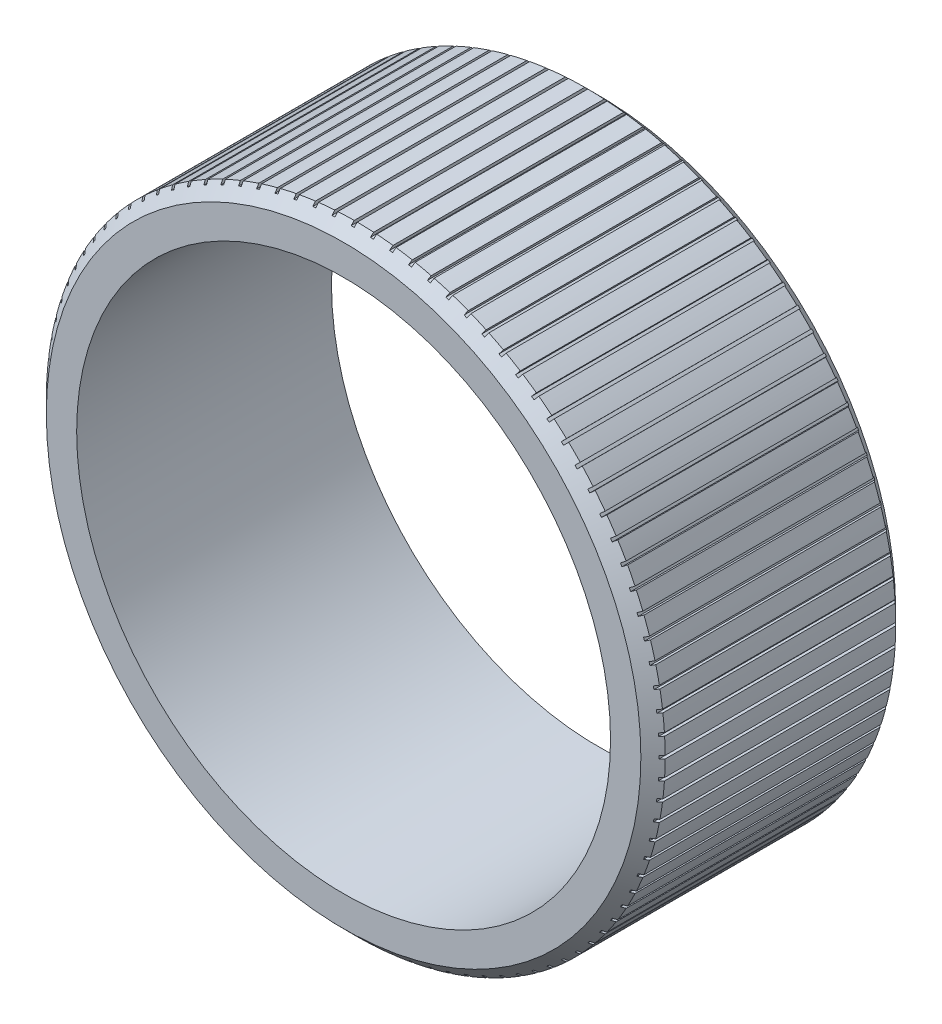
from build123d import *

# Parameters (mm, degrees)
SKETCH_1_R          = 51
SKETCH_1_R_2        = 44
EXTRUDE_1_DEPTH     = 42
CHAMFER_1_SIZE      = 2
CUT_EXTRUDE_START   = -40.5
CUT_EXTRUDE_1_DEPTH = 39


with BuildPart() as part:
    # 草图1 → 凸台-拉伸1 (new body)
    with BuildSketch(Plane.XY):
        with Locations(Location((0, 0, 0), (0, 0, 180))):
            Circle(SKETCH_1_R)
        with Locations(Location((0, 0, 0), (0, 0, 180))):
            Circle(SKETCH_1_R_2, mode=Mode.SUBTRACT)
    extrude(amount=EXTRUDE_1_DEPTH)

    # 倒角1
    chamfer_1_edges = [part.edges().sort_by_distance(p)[0] for p in [
        (51, 0, 0),
        (51, 0, 42),
    ]]
    chamfer(chamfer_1_edges, length=CHAMFER_1_SIZE)

    # 草图4 → 切除-拉伸1 (cut)
    with BuildSketch(Plane(origin=(0, 0, 0), x_dir=(-1, 0, 0), z_dir=(0, 0, -1)).offset(CUT_EXTRUDE_START)):
        with BuildLine():
            Line((-0.25, 50.999387251), (-0.25, 50.499381184))
            ThreePointArc((-0.25, 50.499381184), (0, 50.5), (0.25, 50.499381184))
            Line((0.25, 50.499381184), (0.25, 50.999387251))
            ThreePointArc((0.25, 50.999387251), (0, 51), (-0.25, 50.999387251))
        make_face()
        with BuildLine():
            Line((3.451784703, 50.88305398), (3.420389063, 50.384034561))
            ThreePointArc((3.420389063, 50.384034561), (3.170921236, 50.400349786), (2.921375698, 50.415429821))
            Line((2.921375698, 50.415429821), (2.952771339, 50.91444924))
            ThreePointArc((2.952771339, 50.91444924), (3.202316496, 50.89936315), (3.451784703, 50.88305398))
        make_face()
        with BuildLine():
            Line((6.639946789, 50.565908542), (6.577279412, 50.069845172))
            ThreePointArc((6.577279412, 50.069845172), (6.329328295, 50.101792416), (6.081222061, 50.132511789))
            Line((6.081222061, 50.132511789), (6.143889439, 50.628575158))
            ThreePointArc((6.143889439, 50.628575158), (6.391994912, 50.597849767), (6.639946789, 50.565908542))
        make_face()
        with BuildLine():
            Line((9.801904039, 50.049202563), (9.708212245, 49.558052978))
            ThreePointArc((9.708212245, 49.558052978), (9.462756387, 49.605506162), (9.217068619, 49.651743636))
            Line((9.217068619, 49.651743636), (9.310760414, 50.14289322))
            ThreePointArc((9.310760414, 50.14289322), (9.556447044, 50.096649787), (9.801904039, 50.049202563))
        make_face()
        with BuildLine():
            Line((12.925177651, 49.334975248), (12.800831199, 48.850677791))
            ThreePointArc((12.800831199, 48.850677791), (12.558839302, 48.913449637), (12.316539618, 48.975022734))
            Line((12.316539618, 48.975022734), (12.440886071, 49.459320191))
            ThreePointArc((12.440886071, 49.459320191), (12.683184245, 49.397741218), (12.925177651, 49.334975248))
        make_face()
        with BuildLine():
            Line((15.997441492, 48.426045324), (15.84293112, 47.950511296))
            ThreePointArc((15.84293112, 47.950511296), (15.605358216, 48.028354073), (15.367402862, 48.105019793))
            Line((15.367402862, 48.105019793), (15.521913234, 48.580553821))
            ThreePointArc((15.521913234, 48.580553821), (15.759866713, 48.503882331), (15.997441492, 48.426045324))
        make_face()
        with BuildLine():
            Line((19.006570741, 47.325999923), (18.822506231, 46.861106039))
            ThreePointArc((18.822506231, 46.861106039), (18.590289911, 46.953712537), (18.357617988, 47.045168315))
            Line((18.357617988, 47.045168315), (18.541682498, 47.510062199))
            ThreePointArc((18.541682498, 47.510062199), (18.774352187, 47.41860078), (19.006570741, 47.325999923))
        make_face()
        with BuildLine():
            Line((21.940689737, 46.039180421), (21.727797508, 45.586761405))
            ThreePointArc((21.727797508, 45.586761405), (21.501854224, 45.69376615), (21.275383982, 45.799651051))
            Line((21.275383982, 45.799651051), (21.488276211, 46.252070067))
            ThreePointArc((21.488276211, 46.252070067), (21.71474387, 46.146179676), (21.940689737, 46.039180421))
        make_face()
        with BuildLine():
            Line((24.788218855, 44.570665308), (24.547339095, 44.132506651))
            ThreePointArc((24.547339095, 44.132506651), (24.328560542, 44.253487342), (24.109185755, 44.373383488))
            Line((24.109185755, 44.373383488), (24.350065515, 44.811542145))
            ThreePointArc((24.350065515, 44.811542145), (24.569437379, 44.691640682), (24.788218855, 44.570665308))
        make_face()
        with BuildLine():
            Line((27.537920198, 42.926250141), (27.27000355, 42.504081056))
            ThreePointArc((27.27000355, 42.504081056), (27.059253146, 42.638560238), (26.847839587, 42.771994453))
            Line((26.847839587, 42.771994453), (27.115756235, 43.194163538))
            ThreePointArc((27.115756235, 43.194163538), (27.327166544, 43.060724201), (27.537920198, 42.926250141))
        make_face()
        with BuildLine():
            Line((30.178941951, 41.112424676), (29.885045759, 40.70791127))
            ThreePointArc((29.885045759, 40.70791127), (29.683155241, 40.855358216), (29.480537261, 41.001803897))
            Line((29.480537261, 41.001803897), (29.774433454, 41.406317302))
            ThreePointArc((29.774433454, 41.406317302), (29.977047867, 41.259866713), (30.178941951, 41.112424676))
        make_face()
        with BuildLine():
            Line((32.700861207, 39.136347253), (32.382145345, 38.751085957))
            ThreePointArc((32.382145345, 38.751085957), (32.189911482, 38.91091876), (31.996888724, 39.069797952))
            Line((31.996888724, 39.069797952), (32.315604586, 39.455059248))
            ThreePointArc((32.315604586, 39.455059248), (32.508623477, 39.296175382), (32.700861207, 39.136347253))
        make_face()
        with BuildLine():
            Line((35.093725104, 37.005816547), (34.751447398, 36.641327811))
            ThreePointArc((34.751447398, 36.641327811), (34.569628849, 36.812915685), (34.386963084, 36.983601364))
            Line((34.386963084, 36.983601364), (34.72924079, 37.3480901))
            ThreePointArc((34.72924079, 37.3480901), (34.911902402, 37.177399998), (35.093725104, 37.005816547))
        make_face()
        with BuildLine():
            Line((37.3480901, 34.72924079), (36.983601364, 34.386963084))
            ThreePointArc((36.983601364, 34.386963084), (36.812915685, 34.569628849), (36.641327811, 34.751447398))
            Line((36.641327811, 34.751447398), (37.005816547, 35.093725104))
            ThreePointArc((37.005816547, 35.093725104), (37.177399998, 34.911902402), (37.3480901, 34.72924079))
        make_face()
        with BuildLine():
            Line((39.455059248, 32.315604586), (39.069797952, 31.996888724))
            ThreePointArc((39.069797952, 31.996888724), (38.91091876, 32.189911482), (38.751085957, 32.382145345))
            Line((38.751085957, 32.382145345), (39.136347253, 32.700861207))
            ThreePointArc((39.136347253, 32.700861207), (39.296175382, 32.508623477), (39.455059248, 32.315604586))
        make_face()
        with BuildLine():
            Line((41.406317302, 29.774433454), (41.001803897, 29.480537261))
            ThreePointArc((41.001803897, 29.480537261), (40.855358216, 29.683155241), (40.70791127, 29.885045759))
            Line((40.70791127, 29.885045759), (41.112424676, 30.178941951))
            ThreePointArc((41.112424676, 30.178941951), (41.259866713, 29.977047867), (41.406317302, 29.774433454))
        make_face()
        with BuildLine():
            Line((43.194163538, 27.115756235), (42.771994453, 26.847839587))
            ThreePointArc((42.771994453, 26.847839587), (42.638560238, 27.059253146), (42.504081056, 27.27000355))
            Line((42.504081056, 27.27000355), (42.926250141, 27.537920198))
            ThreePointArc((42.926250141, 27.537920198), (43.060724201, 27.327166544), (43.194163538, 27.115756235))
        make_face()
        with BuildLine():
            Line((44.811542145, 24.350065515), (44.373383488, 24.109185755))
            ThreePointArc((44.373383488, 24.109185755), (44.253487342, 24.328560542), (44.132506651, 24.547339095))
            Line((44.132506651, 24.547339095), (44.570665308, 24.788218855))
            ThreePointArc((44.570665308, 24.788218855), (44.691640682, 24.569437379), (44.811542145, 24.350065515))
        make_face()
        with BuildLine():
            Line((46.252070067, 21.488276211), (45.799651051, 21.275383982))
            ThreePointArc((45.799651051, 21.275383982), (45.69376615, 21.501854224), (45.586761405, 21.727797508))
            Line((45.586761405, 21.727797508), (46.039180421, 21.940689737))
            ThreePointArc((46.039180421, 21.940689737), (46.146179676, 21.71474387), (46.252070067, 21.488276211))
        make_face()
        with BuildLine():
            Line((47.510062199, 18.541682498), (47.045168315, 18.357617988))
            ThreePointArc((47.045168315, 18.357617988), (46.953712537, 18.590289911), (46.861106039, 18.822506231))
            Line((46.861106039, 18.822506231), (47.325999923, 19.006570741))
            ThreePointArc((47.325999923, 19.006570741), (47.41860078, 18.774352187), (47.510062199, 18.541682498))
        make_face()
        with BuildLine():
            Line((48.580553821, 15.521913234), (48.105019793, 15.367402862))
            ThreePointArc((48.105019793, 15.367402862), (48.028354073, 15.605358216), (47.950511296, 15.84293112))
            Line((47.950511296, 15.84293112), (48.426045324, 15.997441492))
            ThreePointArc((48.426045324, 15.997441492), (48.503882331, 15.759866713), (48.580553821, 15.521913234))
        make_face()
        with BuildLine():
            Line((49.459320191, 12.440886071), (48.975022734, 12.316539618))
            ThreePointArc((48.975022734, 12.316539618), (48.913449637, 12.558839302), (48.850677791, 12.800831199))
            Line((48.850677791, 12.800831199), (49.334975248, 12.925177651))
            ThreePointArc((49.334975248, 12.925177651), (49.397741218, 12.683184245), (49.459320191, 12.440886071))
        make_face()
        with BuildLine():
            Line((50.14289322, 9.310760414), (49.651743636, 9.217068619))
            ThreePointArc((49.651743636, 9.217068619), (49.605506162, 9.462756387), (49.558052978, 9.708212245))
            Line((49.558052978, 9.708212245), (50.049202563, 9.801904039))
            ThreePointArc((50.049202563, 9.801904039), (50.096649787, 9.556447044), (50.14289322, 9.310760414))
        make_face()
        with BuildLine():
            Line((50.628575158, 6.143889439), (50.132511789, 6.081222061))
            ThreePointArc((50.132511789, 6.081222061), (50.101792416, 6.329328295), (50.069845172, 6.577279412))
            Line((50.069845172, 6.577279412), (50.565908542, 6.639946789))
            ThreePointArc((50.565908542, 6.639946789), (50.597849767, 6.391994912), (50.628575158, 6.143889439))
        make_face()
        with BuildLine():
            Line((50.91444924, 2.952771339), (50.415429821, 2.921375698))
            ThreePointArc((50.415429821, 2.921375698), (50.400349786, 3.170921236), (50.384034561, 3.420389063))
            Line((50.384034561, 3.420389063), (50.88305398, 3.451784703))
            ThreePointArc((50.88305398, 3.451784703), (50.89936315, 3.202316496), (50.91444924, 2.952771339))
        make_face()
        with BuildLine():
            Line((50.999387251, -0.25), (50.499381184, -0.25))
            ThreePointArc((50.499381184, -0.25), (50.5, 0), (50.499381184, 0.25))
            Line((50.499381184, 0.25), (50.999387251, 0.25))
            ThreePointArc((50.999387251, 0.25), (51, 0), (50.999387251, -0.25))
        make_face()
        with BuildLine():
            Line((50.88305398, -3.451784703), (50.384034561, -3.420389063))
            ThreePointArc((50.384034561, -3.420389063), (50.400349786, -3.170921236), (50.415429821, -2.921375698))
            Line((50.415429821, -2.921375698), (50.91444924, -2.952771339))
            ThreePointArc((50.91444924, -2.952771339), (50.89936315, -3.202316496), (50.88305398, -3.451784703))
        make_face()
        with BuildLine():
            Line((50.565908542, -6.639946789), (50.069845172, -6.577279412))
            ThreePointArc((50.069845172, -6.577279412), (50.101792416, -6.329328295), (50.132511789, -6.081222061))
            Line((50.132511789, -6.081222061), (50.628575158, -6.143889439))
            ThreePointArc((50.628575158, -6.143889439), (50.597849767, -6.391994912), (50.565908542, -6.639946789))
        make_face()
        with BuildLine():
            Line((50.049202563, -9.801904039), (49.558052978, -9.708212245))
            ThreePointArc((49.558052978, -9.708212245), (49.605506162, -9.462756387), (49.651743636, -9.217068619))
            Line((49.651743636, -9.217068619), (50.14289322, -9.310760414))
            ThreePointArc((50.14289322, -9.310760414), (50.096649787, -9.556447044), (50.049202563, -9.801904039))
        make_face()
        with BuildLine():
            Line((49.334975248, -12.925177651), (48.850677791, -12.800831199))
            ThreePointArc((48.850677791, -12.800831199), (48.913449637, -12.558839302), (48.975022734, -12.316539618))
            Line((48.975022734, -12.316539618), (49.459320191, -12.440886071))
            ThreePointArc((49.459320191, -12.440886071), (49.397741218, -12.683184245), (49.334975248, -12.925177651))
        make_face()
        with BuildLine():
            Line((48.426045324, -15.997441492), (47.950511296, -15.84293112))
            ThreePointArc((47.950511296, -15.84293112), (48.028354073, -15.605358216), (48.105019793, -15.367402862))
            Line((48.105019793, -15.367402862), (48.580553821, -15.521913234))
            ThreePointArc((48.580553821, -15.521913234), (48.503882331, -15.759866713), (48.426045324, -15.997441492))
        make_face()
        with BuildLine():
            Line((47.325999923, -19.006570741), (46.861106039, -18.822506231))
            ThreePointArc((46.861106039, -18.822506231), (46.953712537, -18.590289911), (47.045168315, -18.357617988))
            Line((47.045168315, -18.357617988), (47.510062199, -18.541682498))
            ThreePointArc((47.510062199, -18.541682498), (47.41860078, -18.774352187), (47.325999923, -19.006570741))
        make_face()
        with BuildLine():
            Line((46.039180421, -21.940689737), (45.586761405, -21.727797508))
            ThreePointArc((45.586761405, -21.727797508), (45.69376615, -21.501854224), (45.799651051, -21.275383982))
            Line((45.799651051, -21.275383982), (46.252070067, -21.488276211))
            ThreePointArc((46.252070067, -21.488276211), (46.146179676, -21.71474387), (46.039180421, -21.940689737))
        make_face()
        with BuildLine():
            Line((44.570665308, -24.788218855), (44.132506651, -24.547339095))
            ThreePointArc((44.132506651, -24.547339095), (44.253487342, -24.328560542), (44.373383488, -24.109185755))
            Line((44.373383488, -24.109185755), (44.811542145, -24.350065515))
            ThreePointArc((44.811542145, -24.350065515), (44.691640682, -24.569437379), (44.570665308, -24.788218855))
        make_face()
        with BuildLine():
            Line((42.926250141, -27.537920198), (42.504081056, -27.27000355))
            ThreePointArc((42.504081056, -27.27000355), (42.638560238, -27.059253146), (42.771994453, -26.847839587))
            Line((42.771994453, -26.847839587), (43.194163538, -27.115756235))
            ThreePointArc((43.194163538, -27.115756235), (43.060724201, -27.327166544), (42.926250141, -27.537920198))
        make_face()
        with BuildLine():
            Line((41.112424676, -30.178941951), (40.70791127, -29.885045759))
            ThreePointArc((40.70791127, -29.885045759), (40.855358216, -29.683155241), (41.001803897, -29.480537261))
            Line((41.001803897, -29.480537261), (41.406317302, -29.774433454))
            ThreePointArc((41.406317302, -29.774433454), (41.259866713, -29.977047867), (41.112424676, -30.178941951))
        make_face()
        with BuildLine():
            Line((39.136347253, -32.700861207), (38.751085957, -32.382145345))
            ThreePointArc((38.751085957, -32.382145345), (38.91091876, -32.189911482), (39.069797952, -31.996888724))
            Line((39.069797952, -31.996888724), (39.455059248, -32.315604586))
            ThreePointArc((39.455059248, -32.315604586), (39.296175382, -32.508623477), (39.136347253, -32.700861207))
        make_face()
        with BuildLine():
            Line((37.005816547, -35.093725104), (36.641327811, -34.751447398))
            ThreePointArc((36.641327811, -34.751447398), (36.812915685, -34.569628849), (36.983601364, -34.386963084))
            Line((36.983601364, -34.386963084), (37.3480901, -34.72924079))
            ThreePointArc((37.3480901, -34.72924079), (37.177399998, -34.911902402), (37.005816547, -35.093725104))
        make_face()
        with BuildLine():
            Line((34.72924079, -37.3480901), (34.386963084, -36.983601364))
            ThreePointArc((34.386963084, -36.983601364), (34.569628849, -36.812915685), (34.751447398, -36.641327811))
            Line((34.751447398, -36.641327811), (35.093725104, -37.005816547))
            ThreePointArc((35.093725104, -37.005816547), (34.911902402, -37.177399998), (34.72924079, -37.3480901))
        make_face()
        with BuildLine():
            Line((32.315604586, -39.455059248), (31.996888724, -39.069797952))
            ThreePointArc((31.996888724, -39.069797952), (32.189911482, -38.91091876), (32.382145345, -38.751085957))
            Line((32.382145345, -38.751085957), (32.700861207, -39.136347253))
            ThreePointArc((32.700861207, -39.136347253), (32.508623477, -39.296175382), (32.315604586, -39.455059248))
        make_face()
        with BuildLine():
            Line((29.774433454, -41.406317302), (29.480537261, -41.001803897))
            ThreePointArc((29.480537261, -41.001803897), (29.683155241, -40.855358216), (29.885045759, -40.70791127))
            Line((29.885045759, -40.70791127), (30.178941951, -41.112424676))
            ThreePointArc((30.178941951, -41.112424676), (29.977047867, -41.259866713), (29.774433454, -41.406317302))
        make_face()
        with BuildLine():
            Line((27.115756235, -43.194163538), (26.847839587, -42.771994453))
            ThreePointArc((26.847839587, -42.771994453), (27.059253146, -42.638560238), (27.27000355, -42.504081056))
            Line((27.27000355, -42.504081056), (27.537920198, -42.926250141))
            ThreePointArc((27.537920198, -42.926250141), (27.327166544, -43.060724201), (27.115756235, -43.194163538))
        make_face()
        with BuildLine():
            Line((24.350065515, -44.811542145), (24.109185755, -44.373383488))
            ThreePointArc((24.109185755, -44.373383488), (24.328560542, -44.253487342), (24.547339095, -44.132506651))
            Line((24.547339095, -44.132506651), (24.788218855, -44.570665308))
            ThreePointArc((24.788218855, -44.570665308), (24.569437379, -44.691640682), (24.350065515, -44.811542145))
        make_face()
        with BuildLine():
            Line((21.488276211, -46.252070067), (21.275383982, -45.799651051))
            ThreePointArc((21.275383982, -45.799651051), (21.501854224, -45.69376615), (21.727797508, -45.586761405))
            Line((21.727797508, -45.586761405), (21.940689737, -46.039180421))
            ThreePointArc((21.940689737, -46.039180421), (21.71474387, -46.146179676), (21.488276211, -46.252070067))
        make_face()
        with BuildLine():
            Line((18.541682498, -47.510062199), (18.357617988, -47.045168315))
            ThreePointArc((18.357617988, -47.045168315), (18.590289911, -46.953712537), (18.822506231, -46.861106039))
            Line((18.822506231, -46.861106039), (19.006570741, -47.325999923))
            ThreePointArc((19.006570741, -47.325999923), (18.774352187, -47.41860078), (18.541682498, -47.510062199))
        make_face()
        with BuildLine():
            Line((15.521913234, -48.580553821), (15.367402862, -48.105019793))
            ThreePointArc((15.367402862, -48.105019793), (15.605358216, -48.028354073), (15.84293112, -47.950511296))
            Line((15.84293112, -47.950511296), (15.997441492, -48.426045324))
            ThreePointArc((15.997441492, -48.426045324), (15.759866713, -48.503882331), (15.521913234, -48.580553821))
        make_face()
        with BuildLine():
            Line((12.440886071, -49.459320191), (12.316539618, -48.975022734))
            ThreePointArc((12.316539618, -48.975022734), (12.558839302, -48.913449637), (12.800831199, -48.850677791))
            Line((12.800831199, -48.850677791), (12.925177651, -49.334975248))
            ThreePointArc((12.925177651, -49.334975248), (12.683184245, -49.397741218), (12.440886071, -49.459320191))
        make_face()
        with BuildLine():
            Line((9.310760414, -50.14289322), (9.217068619, -49.651743636))
            ThreePointArc((9.217068619, -49.651743636), (9.462756387, -49.605506162), (9.708212245, -49.558052978))
            Line((9.708212245, -49.558052978), (9.801904039, -50.049202563))
            ThreePointArc((9.801904039, -50.049202563), (9.556447044, -50.096649787), (9.310760414, -50.14289322))
        make_face()
        with BuildLine():
            Line((6.143889439, -50.628575158), (6.081222061, -50.132511789))
            ThreePointArc((6.081222061, -50.132511789), (6.329328295, -50.101792416), (6.577279412, -50.069845172))
            Line((6.577279412, -50.069845172), (6.639946789, -50.565908542))
            ThreePointArc((6.639946789, -50.565908542), (6.391994912, -50.597849767), (6.143889439, -50.628575158))
        make_face()
        with BuildLine():
            Line((2.952771339, -50.91444924), (2.921375698, -50.415429821))
            ThreePointArc((2.921375698, -50.415429821), (3.170921236, -50.400349786), (3.420389063, -50.384034561))
            Line((3.420389063, -50.384034561), (3.451784703, -50.88305398))
            ThreePointArc((3.451784703, -50.88305398), (3.202316496, -50.89936315), (2.952771339, -50.91444924))
        make_face()
        with BuildLine():
            Line((-0.25, -50.999387251), (-0.25, -50.499381184))
            ThreePointArc((-0.25, -50.499381184), (0, -50.5), (0.25, -50.499381184))
            Line((0.25, -50.499381184), (0.25, -50.999387251))
            ThreePointArc((0.25, -50.999387251), (0, -51), (-0.25, -50.999387251))
        make_face()
        with BuildLine():
            Line((-3.451784703, -50.88305398), (-3.420389063, -50.384034561))
            ThreePointArc((-3.420389063, -50.384034561), (-3.170921236, -50.400349786), (-2.921375698, -50.415429821))
            Line((-2.921375698, -50.415429821), (-2.952771339, -50.91444924))
            ThreePointArc((-2.952771339, -50.91444924), (-3.202316496, -50.89936315), (-3.451784703, -50.88305398))
        make_face()
        with BuildLine():
            Line((-6.639946789, -50.565908542), (-6.577279412, -50.069845172))
            ThreePointArc((-6.577279412, -50.069845172), (-6.329328295, -50.101792416), (-6.081222061, -50.132511789))
            Line((-6.081222061, -50.132511789), (-6.143889439, -50.628575158))
            ThreePointArc((-6.143889439, -50.628575158), (-6.391994912, -50.597849767), (-6.639946789, -50.565908542))
        make_face()
        with BuildLine():
            Line((-9.801904039, -50.049202563), (-9.708212245, -49.558052978))
            ThreePointArc((-9.708212245, -49.558052978), (-9.462756387, -49.605506162), (-9.217068619, -49.651743636))
            Line((-9.217068619, -49.651743636), (-9.310760414, -50.14289322))
            ThreePointArc((-9.310760414, -50.14289322), (-9.556447044, -50.096649787), (-9.801904039, -50.049202563))
        make_face()
        with BuildLine():
            Line((-12.925177651, -49.334975248), (-12.800831199, -48.850677791))
            ThreePointArc((-12.800831199, -48.850677791), (-12.558839302, -48.913449637), (-12.316539618, -48.975022734))
            Line((-12.316539618, -48.975022734), (-12.440886071, -49.459320191))
            ThreePointArc((-12.440886071, -49.459320191), (-12.683184245, -49.397741218), (-12.925177651, -49.334975248))
        make_face()
        with BuildLine():
            Line((-15.997441492, -48.426045324), (-15.84293112, -47.950511296))
            ThreePointArc((-15.84293112, -47.950511296), (-15.605358216, -48.028354073), (-15.367402862, -48.105019793))
            Line((-15.367402862, -48.105019793), (-15.521913234, -48.580553821))
            ThreePointArc((-15.521913234, -48.580553821), (-15.759866713, -48.503882331), (-15.997441492, -48.426045324))
        make_face()
        with BuildLine():
            Line((-19.006570741, -47.325999923), (-18.822506231, -46.861106039))
            ThreePointArc((-18.822506231, -46.861106039), (-18.590289911, -46.953712537), (-18.357617988, -47.045168315))
            Line((-18.357617988, -47.045168315), (-18.541682498, -47.510062199))
            ThreePointArc((-18.541682498, -47.510062199), (-18.774352187, -47.41860078), (-19.006570741, -47.325999923))
        make_face()
        with BuildLine():
            Line((-21.940689737, -46.039180421), (-21.727797508, -45.586761405))
            ThreePointArc((-21.727797508, -45.586761405), (-21.501854224, -45.69376615), (-21.275383982, -45.799651051))
            Line((-21.275383982, -45.799651051), (-21.488276211, -46.252070067))
            ThreePointArc((-21.488276211, -46.252070067), (-21.71474387, -46.146179676), (-21.940689737, -46.039180421))
        make_face()
        with BuildLine():
            Line((-24.788218855, -44.570665308), (-24.547339095, -44.132506651))
            ThreePointArc((-24.547339095, -44.132506651), (-24.328560542, -44.253487342), (-24.109185755, -44.373383488))
            Line((-24.109185755, -44.373383488), (-24.350065515, -44.811542145))
            ThreePointArc((-24.350065515, -44.811542145), (-24.569437379, -44.691640682), (-24.788218855, -44.570665308))
        make_face()
        with BuildLine():
            Line((-27.537920198, -42.926250141), (-27.27000355, -42.504081056))
            ThreePointArc((-27.27000355, -42.504081056), (-27.059253146, -42.638560238), (-26.847839587, -42.771994453))
            Line((-26.847839587, -42.771994453), (-27.115756235, -43.194163538))
            ThreePointArc((-27.115756235, -43.194163538), (-27.327166544, -43.060724201), (-27.537920198, -42.926250141))
        make_face()
        with BuildLine():
            Line((-30.178941951, -41.112424676), (-29.885045759, -40.70791127))
            ThreePointArc((-29.885045759, -40.70791127), (-29.683155241, -40.855358216), (-29.480537261, -41.001803897))
            Line((-29.480537261, -41.001803897), (-29.774433454, -41.406317302))
            ThreePointArc((-29.774433454, -41.406317302), (-29.977047867, -41.259866713), (-30.178941951, -41.112424676))
        make_face()
        with BuildLine():
            Line((-32.700861207, -39.136347253), (-32.382145345, -38.751085957))
            ThreePointArc((-32.382145345, -38.751085957), (-32.189911482, -38.91091876), (-31.996888724, -39.069797952))
            Line((-31.996888724, -39.069797952), (-32.315604586, -39.455059248))
            ThreePointArc((-32.315604586, -39.455059248), (-32.508623477, -39.296175382), (-32.700861207, -39.136347253))
        make_face()
        with BuildLine():
            Line((-35.093725104, -37.005816547), (-34.751447398, -36.641327811))
            ThreePointArc((-34.751447398, -36.641327811), (-34.569628849, -36.812915685), (-34.386963084, -36.983601364))
            Line((-34.386963084, -36.983601364), (-34.72924079, -37.3480901))
            ThreePointArc((-34.72924079, -37.3480901), (-34.911902402, -37.177399998), (-35.093725104, -37.005816547))
        make_face()
        with BuildLine():
            Line((-37.3480901, -34.72924079), (-36.983601364, -34.386963084))
            ThreePointArc((-36.983601364, -34.386963084), (-36.812915685, -34.569628849), (-36.641327811, -34.751447398))
            Line((-36.641327811, -34.751447398), (-37.005816547, -35.093725104))
            ThreePointArc((-37.005816547, -35.093725104), (-37.177399998, -34.911902402), (-37.3480901, -34.72924079))
        make_face()
        with BuildLine():
            Line((-39.455059248, -32.315604586), (-39.069797952, -31.996888724))
            ThreePointArc((-39.069797952, -31.996888724), (-38.91091876, -32.189911482), (-38.751085957, -32.382145345))
            Line((-38.751085957, -32.382145345), (-39.136347253, -32.700861207))
            ThreePointArc((-39.136347253, -32.700861207), (-39.296175382, -32.508623477), (-39.455059248, -32.315604586))
        make_face()
        with BuildLine():
            Line((-41.406317302, -29.774433454), (-41.001803897, -29.480537261))
            ThreePointArc((-41.001803897, -29.480537261), (-40.855358216, -29.683155241), (-40.70791127, -29.885045759))
            Line((-40.70791127, -29.885045759), (-41.112424676, -30.178941951))
            ThreePointArc((-41.112424676, -30.178941951), (-41.259866713, -29.977047867), (-41.406317302, -29.774433454))
        make_face()
        with BuildLine():
            Line((-43.194163538, -27.115756235), (-42.771994453, -26.847839587))
            ThreePointArc((-42.771994453, -26.847839587), (-42.638560238, -27.059253146), (-42.504081056, -27.27000355))
            Line((-42.504081056, -27.27000355), (-42.926250141, -27.537920198))
            ThreePointArc((-42.926250141, -27.537920198), (-43.060724201, -27.327166544), (-43.194163538, -27.115756235))
        make_face()
        with BuildLine():
            Line((-44.811542145, -24.350065515), (-44.373383488, -24.109185755))
            ThreePointArc((-44.373383488, -24.109185755), (-44.253487342, -24.328560542), (-44.132506651, -24.547339095))
            Line((-44.132506651, -24.547339095), (-44.570665308, -24.788218855))
            ThreePointArc((-44.570665308, -24.788218855), (-44.691640682, -24.569437379), (-44.811542145, -24.350065515))
        make_face()
        with BuildLine():
            Line((-46.252070067, -21.488276211), (-45.799651051, -21.275383982))
            ThreePointArc((-45.799651051, -21.275383982), (-45.69376615, -21.501854224), (-45.586761405, -21.727797508))
            Line((-45.586761405, -21.727797508), (-46.039180421, -21.940689737))
            ThreePointArc((-46.039180421, -21.940689737), (-46.146179676, -21.71474387), (-46.252070067, -21.488276211))
        make_face()
        with BuildLine():
            Line((-47.510062199, -18.541682498), (-47.045168315, -18.357617988))
            ThreePointArc((-47.045168315, -18.357617988), (-46.953712537, -18.590289911), (-46.861106039, -18.822506231))
            Line((-46.861106039, -18.822506231), (-47.325999923, -19.006570741))
            ThreePointArc((-47.325999923, -19.006570741), (-47.41860078, -18.774352187), (-47.510062199, -18.541682498))
        make_face()
        with BuildLine():
            Line((-48.580553821, -15.521913234), (-48.105019793, -15.367402862))
            ThreePointArc((-48.105019793, -15.367402862), (-48.028354073, -15.605358216), (-47.950511296, -15.84293112))
            Line((-47.950511296, -15.84293112), (-48.426045324, -15.997441492))
            ThreePointArc((-48.426045324, -15.997441492), (-48.503882331, -15.759866713), (-48.580553821, -15.521913234))
        make_face()
        with BuildLine():
            Line((-49.459320191, -12.440886071), (-48.975022734, -12.316539618))
            ThreePointArc((-48.975022734, -12.316539618), (-48.913449637, -12.558839302), (-48.850677791, -12.800831199))
            Line((-48.850677791, -12.800831199), (-49.334975248, -12.925177651))
            ThreePointArc((-49.334975248, -12.925177651), (-49.397741218, -12.683184245), (-49.459320191, -12.440886071))
        make_face()
        with BuildLine():
            Line((-50.14289322, -9.310760414), (-49.651743636, -9.217068619))
            ThreePointArc((-49.651743636, -9.217068619), (-49.605506162, -9.462756387), (-49.558052978, -9.708212245))
            Line((-49.558052978, -9.708212245), (-50.049202563, -9.801904039))
            ThreePointArc((-50.049202563, -9.801904039), (-50.096649787, -9.556447044), (-50.14289322, -9.310760414))
        make_face()
        with BuildLine():
            Line((-50.628575158, -6.143889439), (-50.132511789, -6.081222061))
            ThreePointArc((-50.132511789, -6.081222061), (-50.101792416, -6.329328295), (-50.069845172, -6.577279412))
            Line((-50.069845172, -6.577279412), (-50.565908542, -6.639946789))
            ThreePointArc((-50.565908542, -6.639946789), (-50.597849767, -6.391994912), (-50.628575158, -6.143889439))
        make_face()
        with BuildLine():
            Line((-50.91444924, -2.952771339), (-50.415429821, -2.921375698))
            ThreePointArc((-50.415429821, -2.921375698), (-50.400349786, -3.170921236), (-50.384034561, -3.420389063))
            Line((-50.384034561, -3.420389063), (-50.88305398, -3.451784703))
            ThreePointArc((-50.88305398, -3.451784703), (-50.89936315, -3.202316496), (-50.91444924, -2.952771339))
        make_face()
        with BuildLine():
            Line((-50.999387251, 0.25), (-50.499381184, 0.25))
            ThreePointArc((-50.499381184, 0.25), (-50.5, 0), (-50.499381184, -0.25))
            Line((-50.499381184, -0.25), (-50.999387251, -0.25))
            ThreePointArc((-50.999387251, -0.25), (-51, 0), (-50.999387251, 0.25))
        make_face()
        with BuildLine():
            Line((-50.88305398, 3.451784703), (-50.384034561, 3.420389063))
            ThreePointArc((-50.384034561, 3.420389063), (-50.400349786, 3.170921236), (-50.415429821, 2.921375698))
            Line((-50.415429821, 2.921375698), (-50.91444924, 2.952771339))
            ThreePointArc((-50.91444924, 2.952771339), (-50.89936315, 3.202316496), (-50.88305398, 3.451784703))
        make_face()
        with BuildLine():
            Line((-50.565908542, 6.639946789), (-50.069845172, 6.577279412))
            ThreePointArc((-50.069845172, 6.577279412), (-50.101792416, 6.329328295), (-50.132511789, 6.081222062))
            Line((-50.132511789, 6.081222062), (-50.628575158, 6.143889439))
            ThreePointArc((-50.628575158, 6.143889439), (-50.597849767, 6.391994912), (-50.565908542, 6.639946789))
        make_face()
        with BuildLine():
            Line((-50.049202563, 9.801904039), (-49.558052978, 9.708212245))
            ThreePointArc((-49.558052978, 9.708212245), (-49.605506162, 9.462756387), (-49.651743636, 9.217068619))
            Line((-49.651743636, 9.217068619), (-50.14289322, 9.310760414))
            ThreePointArc((-50.14289322, 9.310760414), (-50.096649787, 9.556447044), (-50.049202563, 9.801904039))
        make_face()
        with BuildLine():
            Line((-49.334975248, 12.925177651), (-48.850677791, 12.800831199))
            ThreePointArc((-48.850677791, 12.800831199), (-48.913449637, 12.558839302), (-48.975022734, 12.316539618))
            Line((-48.975022734, 12.316539618), (-49.459320191, 12.440886071))
            ThreePointArc((-49.459320191, 12.440886071), (-49.397741218, 12.683184245), (-49.334975248, 12.925177651))
        make_face()
        with BuildLine():
            Line((-48.426045324, 15.997441492), (-47.950511296, 15.84293112))
            ThreePointArc((-47.950511296, 15.84293112), (-48.028354073, 15.605358216), (-48.105019793, 15.367402862))
            Line((-48.105019793, 15.367402862), (-48.580553821, 15.521913234))
            ThreePointArc((-48.580553821, 15.521913234), (-48.503882331, 15.759866713), (-48.426045324, 15.997441492))
        make_face()
        with BuildLine():
            Line((-47.325999923, 19.006570741), (-46.861106039, 18.822506231))
            ThreePointArc((-46.861106039, 18.822506231), (-46.953712537, 18.590289911), (-47.045168315, 18.357617988))
            Line((-47.045168315, 18.357617988), (-47.510062199, 18.541682498))
            ThreePointArc((-47.510062199, 18.541682498), (-47.41860078, 18.774352187), (-47.325999923, 19.006570741))
        make_face()
        with BuildLine():
            Line((-46.039180421, 21.940689737), (-45.586761405, 21.727797508))
            ThreePointArc((-45.586761405, 21.727797508), (-45.69376615, 21.501854224), (-45.799651051, 21.275383982))
            Line((-45.799651051, 21.275383982), (-46.252070067, 21.488276211))
            ThreePointArc((-46.252070067, 21.488276211), (-46.146179676, 21.71474387), (-46.039180421, 21.940689737))
        make_face()
        with BuildLine():
            Line((-44.570665308, 24.788218855), (-44.132506651, 24.547339095))
            ThreePointArc((-44.132506651, 24.547339095), (-44.253487342, 24.328560542), (-44.373383488, 24.109185755))
            Line((-44.373383488, 24.109185755), (-44.811542145, 24.350065515))
            ThreePointArc((-44.811542145, 24.350065515), (-44.691640682, 24.569437379), (-44.570665308, 24.788218855))
        make_face()
        with BuildLine():
            Line((-42.926250141, 27.537920198), (-42.504081056, 27.27000355))
            ThreePointArc((-42.504081056, 27.27000355), (-42.638560238, 27.059253146), (-42.771994453, 26.847839587))
            Line((-42.771994453, 26.847839587), (-43.194163538, 27.115756235))
            ThreePointArc((-43.194163538, 27.115756235), (-43.060724201, 27.327166544), (-42.926250141, 27.537920198))
        make_face()
        with BuildLine():
            Line((-41.112424676, 30.178941951), (-40.70791127, 29.885045759))
            ThreePointArc((-40.70791127, 29.885045759), (-40.855358216, 29.683155241), (-41.001803897, 29.480537261))
            Line((-41.001803897, 29.480537261), (-41.406317302, 29.774433454))
            ThreePointArc((-41.406317302, 29.774433454), (-41.259866713, 29.977047867), (-41.112424676, 30.178941951))
        make_face()
        with BuildLine():
            Line((-39.136347253, 32.700861207), (-38.751085957, 32.382145345))
            ThreePointArc((-38.751085957, 32.382145345), (-38.91091876, 32.189911482), (-39.069797952, 31.996888724))
            Line((-39.069797952, 31.996888724), (-39.455059248, 32.315604586))
            ThreePointArc((-39.455059248, 32.315604586), (-39.296175382, 32.508623477), (-39.136347253, 32.700861207))
        make_face()
        with BuildLine():
            Line((-37.005816547, 35.093725104), (-36.641327811, 34.751447398))
            ThreePointArc((-36.641327811, 34.751447398), (-36.812915685, 34.569628849), (-36.983601364, 34.386963084))
            Line((-36.983601364, 34.386963084), (-37.3480901, 34.72924079))
            ThreePointArc((-37.3480901, 34.72924079), (-37.177399998, 34.911902402), (-37.005816547, 35.093725104))
        make_face()
        with BuildLine():
            Line((-34.72924079, 37.3480901), (-34.386963084, 36.983601364))
            ThreePointArc((-34.386963084, 36.983601364), (-34.569628849, 36.812915685), (-34.751447398, 36.641327811))
            Line((-34.751447398, 36.641327811), (-35.093725104, 37.005816547))
            ThreePointArc((-35.093725104, 37.005816547), (-34.911902402, 37.177399998), (-34.72924079, 37.3480901))
        make_face()
        with BuildLine():
            Line((-32.315604586, 39.455059248), (-31.996888724, 39.069797952))
            ThreePointArc((-31.996888724, 39.069797952), (-32.189911482, 38.91091876), (-32.382145345, 38.751085957))
            Line((-32.382145345, 38.751085957), (-32.700861207, 39.136347253))
            ThreePointArc((-32.700861207, 39.136347253), (-32.508623477, 39.296175382), (-32.315604586, 39.455059248))
        make_face()
        with BuildLine():
            Line((-29.774433454, 41.406317302), (-29.480537261, 41.001803897))
            ThreePointArc((-29.480537261, 41.001803897), (-29.683155241, 40.855358216), (-29.885045759, 40.70791127))
            Line((-29.885045759, 40.70791127), (-30.178941951, 41.112424676))
            ThreePointArc((-30.178941951, 41.112424676), (-29.977047867, 41.259866713), (-29.774433454, 41.406317302))
        make_face()
        with BuildLine():
            Line((-27.115756235, 43.194163538), (-26.847839587, 42.771994453))
            ThreePointArc((-26.847839587, 42.771994453), (-27.059253146, 42.638560238), (-27.27000355, 42.504081056))
            Line((-27.27000355, 42.504081056), (-27.537920198, 42.926250141))
            ThreePointArc((-27.537920198, 42.926250141), (-27.327166544, 43.060724201), (-27.115756235, 43.194163538))
        make_face()
        with BuildLine():
            Line((-24.350065515, 44.811542145), (-24.109185755, 44.373383488))
            ThreePointArc((-24.109185755, 44.373383488), (-24.328560542, 44.253487342), (-24.547339095, 44.132506651))
            Line((-24.547339095, 44.132506651), (-24.788218855, 44.570665308))
            ThreePointArc((-24.788218855, 44.570665308), (-24.569437379, 44.691640682), (-24.350065515, 44.811542145))
        make_face()
        with BuildLine():
            Line((-21.488276211, 46.252070067), (-21.275383982, 45.799651051))
            ThreePointArc((-21.275383982, 45.799651051), (-21.501854224, 45.69376615), (-21.727797508, 45.586761405))
            Line((-21.727797508, 45.586761405), (-21.940689737, 46.039180421))
            ThreePointArc((-21.940689737, 46.039180421), (-21.71474387, 46.146179676), (-21.488276211, 46.252070067))
        make_face()
        with BuildLine():
            Line((-18.541682498, 47.510062199), (-18.357617988, 47.045168315))
            ThreePointArc((-18.357617988, 47.045168315), (-18.590289911, 46.953712537), (-18.822506231, 46.861106039))
            Line((-18.822506231, 46.861106039), (-19.006570741, 47.325999923))
            ThreePointArc((-19.006570741, 47.325999923), (-18.774352187, 47.41860078), (-18.541682498, 47.510062199))
        make_face()
        with BuildLine():
            Line((-15.521913234, 48.580553821), (-15.367402862, 48.105019793))
            ThreePointArc((-15.367402862, 48.105019793), (-15.605358216, 48.028354073), (-15.84293112, 47.950511296))
            Line((-15.84293112, 47.950511296), (-15.997441492, 48.426045324))
            ThreePointArc((-15.997441492, 48.426045324), (-15.759866713, 48.503882331), (-15.521913234, 48.580553821))
        make_face()
        with BuildLine():
            Line((-12.440886071, 49.459320191), (-12.316539618, 48.975022734))
            ThreePointArc((-12.316539618, 48.975022734), (-12.558839302, 48.913449637), (-12.800831199, 48.850677791))
            Line((-12.800831199, 48.850677791), (-12.925177651, 49.334975248))
            ThreePointArc((-12.925177651, 49.334975248), (-12.683184245, 49.397741218), (-12.440886071, 49.459320191))
        make_face()
        with BuildLine():
            Line((-9.310760414, 50.14289322), (-9.217068619, 49.651743636))
            ThreePointArc((-9.217068619, 49.651743636), (-9.462756387, 49.605506162), (-9.708212245, 49.558052978))
            Line((-9.708212245, 49.558052978), (-9.801904039, 50.049202563))
            ThreePointArc((-9.801904039, 50.049202563), (-9.556447044, 50.096649787), (-9.310760414, 50.14289322))
        make_face()
        with BuildLine():
            Line((-6.143889439, 50.628575158), (-6.081222061, 50.132511789))
            ThreePointArc((-6.081222061, 50.132511789), (-6.329328295, 50.101792416), (-6.577279412, 50.069845172))
            Line((-6.577279412, 50.069845172), (-6.639946789, 50.565908542))
            ThreePointArc((-6.639946789, 50.565908542), (-6.391994912, 50.597849767), (-6.143889439, 50.628575158))
        make_face()
        with BuildLine():
            Line((-2.952771339, 50.91444924), (-2.921375698, 50.415429821))
            ThreePointArc((-2.921375698, 50.415429821), (-3.170921236, 50.400349786), (-3.420389063, 50.384034561))
            Line((-3.420389063, 50.384034561), (-3.451784703, 50.88305398))
            ThreePointArc((-3.451784703, 50.88305398), (-3.202316496, 50.89936315), (-2.952771339, 50.91444924))
        make_face()
    extrude(amount=CUT_EXTRUDE_1_DEPTH, mode=Mode.SUBTRACT)


solid = part.part
